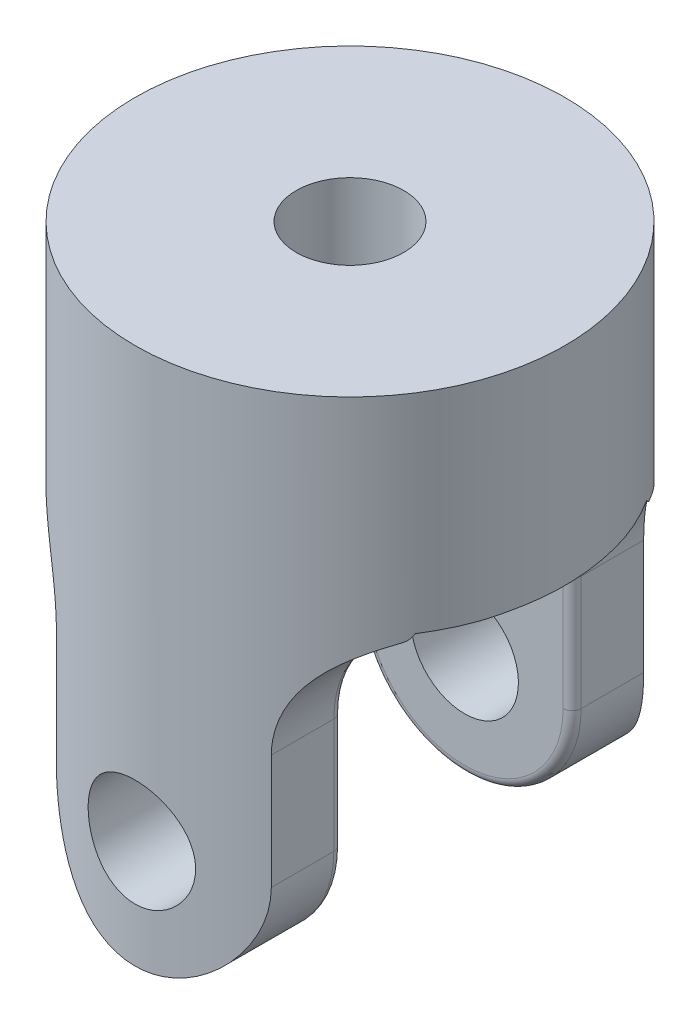
from build123d import *

# Parameters (mm, degrees)
SKETCH1_R               = 19.05
BASE_EXTRUDE_DEPTH      = 47.625
CUT_EXTRUDE1_DEPTH      = 55.716959208
CUT_EXTRUDE1_DEPTH_BACK = 55.716959208
CUT_EXTRUDE5_DEPTH      = 47.625
CUT_EXTRUDE5_DEPTH_BACK = 55.716959365
SKETCH8_W               = 20.32
SKETCH8_H               = 36.600526062
FILLET1_R               = 0.8001
CUT_EXTRUDE6_DEPTH      = 55.716959365
CUT_EXTRUDE6_DEPTH_BACK = 55.716959365
SKETCH11_R              = 4.7625
SKETCH12_R              = 4.7625
CUT_EXTRUDE7_DEPTH      = 55.716959365


with BuildPart() as part:
    # Sketch1 → Base-Extrude (new body)
    with BuildSketch(Plane(origin=(0, 0, 0), x_dir=(-1, 0, 0), z_dir=(0, 1, 0))):
        with Locations(Location((0, 0, 0), (0, 0, 90))):
            Circle(SKETCH1_R)
    extrude(amount=BASE_EXTRUDE_DEPTH)

    # Sketch2 → Cut-Extrude1 (cut, two sides: drawn at the far end of the back side and taken through both)
    with BuildSketch(Plane.XY.offset(-CUT_EXTRUDE1_DEPTH_BACK)):
        with BuildLine():
            Line((9.525, 9.525), (9.525, 19.685))
            ThreePointArc((9.525, 19.685), (12.314807909, 26.420192091), (19.05, 29.21))
            Line((19.05, 29.21), (19.05, -1.366191125))
            Line((19.05, -1.366191125), (-19.05, -1.366191125))
            Line((-19.05, -1.366191125), (-19.05, 29.21))
            ThreePointArc((-19.05, 29.21), (-12.314807909, 26.420192091), (-9.525, 19.685))
            Line((-9.525, 19.685), (-9.525, 9.525))
            ThreePointArc((-9.525, 9.525), (0, 0), (9.525, 9.525))
        make_face()
    extrude(amount=CUT_EXTRUDE1_DEPTH + CUT_EXTRUDE1_DEPTH_BACK, mode=Mode.SUBTRACT)

    # Sketch8 → Cut-Extrude5 (cut, two sides: drawn at the far end of the back side and taken through both)
    with BuildSketch(Plane(origin=(0, 0, 0), x_dir=(0, 0, -1), z_dir=(1, 0, 0)).offset(-CUT_EXTRUDE5_DEPTH_BACK)):
        with Locations((0, 10.844975795)):
            Rectangle(SKETCH8_W, SKETCH8_H)
    extrude(amount=CUT_EXTRUDE5_DEPTH + CUT_EXTRUDE5_DEPTH_BACK, mode=Mode.SUBTRACT)

    # Fillet1
    # the kernel refuses this fillet: 0.8001 mm, written as the material it takes off along each edge
    with BuildSketch(Plane(origin=(0, 9.525, -10.16), x_dir=(1, 0, 0), z_dir=(0, 1, 0))) as fillet1_piece_1:
        with BuildLine():
            CenterArc((9.525 - FILLET1_R, FILLET1_R), FILLET1_R, 270, 90)
            Line((9.525, FILLET1_R), (9.525, 0))
            Line((9.525, 0), (9.525 - FILLET1_R, 0))
        make_face()
    revolve(axis=Axis((0, 9.525, -10.16), (0, 0, -1)), revolution_arc=180, mode=Mode.SUBTRACT)
    with BuildSketch(Plane(origin=(0, 9.525, 10.16), x_dir=(1, 0, 0), z_dir=(0, 1, 0))) as fillet1_piece_2:
        with BuildLine():
            CenterArc((9.525 - FILLET1_R, -FILLET1_R), FILLET1_R, 0, 90)
            Line((9.525 - FILLET1_R, 0), (9.525, 0))
            Line((9.525, 0), (9.525, -FILLET1_R))
        make_face()
    revolve(axis=Axis((0, 9.525, 10.16), (0, 0, -1)), revolution_arc=180, mode=Mode.SUBTRACT)
    with BuildSketch(Plane(origin=(9.525, 19.685, 10.16), x_dir=(0, 0, 1), z_dir=(0, -1, 0))) as fillet1_piece_3:
        with BuildLine():
            CenterArc((FILLET1_R, FILLET1_R), FILLET1_R, 180, 90)
            Line((0, FILLET1_R), (0, 0))
            Line((0, 0), (FILLET1_R, 0))
        make_face()
    extrude(amount=10.16, mode=Mode.SUBTRACT)
    with BuildSketch(Plane(origin=(19.05, 19.685, 10.16), x_dir=(-1, 0, 0), z_dir=(0, -1, 0))) as fillet1_piece_4_section:
        with BuildLine():
            CenterArc((9.525 + FILLET1_R, -FILLET1_R), FILLET1_R, 90, 90)
            Line((9.525 + FILLET1_R, 0), (9.525, 0))
            Line((9.525, 0), (9.525, -FILLET1_R))
        make_face()
    fillet1_piece_4 = revolve(axis=Axis((19.05, 19.685, 10.16), (0, 0, -1)), revolution_arc=84.085046105, mode=Mode.PRIVATE)
    fillet1_piece_4 = split(fillet1_piece_4, bisect_by=Plane(origin=(11.180350867, 29.145238826, 10.386376784), z_dir=(0, -1, 0)), keep=Keep.TOP, mode=Mode.PRIVATE)
    add(fillet1_piece_4, mode=Mode.SUBTRACT)
    with BuildSketch(Plane(origin=(19.05, 19.685, -10.16), x_dir=(-1, 0, 0), z_dir=(0, -1, 0))) as fillet1_piece_5_section:
        with BuildLine():
            CenterArc((9.525 + FILLET1_R, FILLET1_R), FILLET1_R, 180, 90)
            Line((9.525, FILLET1_R), (9.525, 0))
            Line((9.525, 0), (9.525 + FILLET1_R, 0))
        make_face()
    fillet1_piece_5 = revolve(axis=Axis((19.05, 19.685, -10.16), (0, 0, -1)), revolution_arc=84.085046117, mode=Mode.PRIVATE)
    fillet1_piece_5 = split(fillet1_piece_5, bisect_by=Plane(origin=(9.358714509, 29.145238826, -10.293177934), z_dir=(0, -1, 0)), keep=Keep.TOP, mode=Mode.PRIVATE)
    add(fillet1_piece_5, mode=Mode.SUBTRACT)
    with BuildSketch(Plane(origin=(9.525, 9.525, -10.16), x_dir=(-1, 0, 0), z_dir=(0, 1, 0)), Plane(origin=(-9.525, 9.525, 10.16), x_dir=(1, 0, 0), z_dir=(0, 1, 0)), Plane(origin=(-9.525, 19.685, -10.16), x_dir=(1, 0, 0), z_dir=(0, -1, 0))) as fillet1_piece_6:
        with BuildLine():
            CenterArc((FILLET1_R, -FILLET1_R), FILLET1_R, 90, 90)
            Line((0, -FILLET1_R), (0, 0))
            Line((0, 0), (FILLET1_R, 0))
        make_face()
    extrude(amount=10.16, mode=Mode.SUBTRACT)
    with BuildSketch(Plane(origin=(-19.05, 19.685, 10.16), x_dir=(0.1030521452465983, 0.9946759549522016, 0), z_dir=(-0.9946759549522016, 0.1030521452465983, 0))) as fillet1_piece_7_section:
        with BuildLine():
            CenterArc((9.525 + FILLET1_R, -FILLET1_R), FILLET1_R, 90, 90)
            Line((9.525, -FILLET1_R), (9.525, 0))
            Line((9.525, 0), (9.525 + FILLET1_R, 0))
        make_face()
    fillet1_piece_7 = revolve(axis=Axis((-19.05, 19.685, 10.16), (0, 0, -1)), revolution_arc=84.085046117, mode=Mode.PRIVATE)
    fillet1_piece_7 = split(fillet1_piece_7, bisect_by=Plane(origin=(-11.180351388, 29.145238826, 10.386376138), z_dir=(0, -1, 0)), keep=Keep.TOP, mode=Mode.PRIVATE)
    add(fillet1_piece_7, mode=Mode.SUBTRACT)
    with BuildSketch(Plane(origin=(-19.05, 19.685, -10.16), x_dir=(0.10305214545411669, 0.9946759549307018, 0), z_dir=(-0.9946759549307018, 0.10305214545411669, 0))) as fillet1_piece_8_section:
        with BuildLine():
            CenterArc((9.525 + FILLET1_R, FILLET1_R), FILLET1_R, 180, 90)
            Line((9.525, FILLET1_R), (9.525, 0))
            Line((9.525, 0), (9.525 + FILLET1_R, 0))
        make_face()
    fillet1_piece_8 = revolve(axis=Axis((-19.05, 19.685, -10.16), (0, 0, -1)), revolution_arc=84.085046105, mode=Mode.PRIVATE)
    fillet1_piece_8 = split(fillet1_piece_8, bisect_by=Plane(origin=(-11.180350867, 29.145238826, -10.386376784), z_dir=(0, -1, 0)), keep=Keep.TOP, mode=Mode.PRIVATE)
    add(fillet1_piece_8, mode=Mode.SUBTRACT)

    # Sketch11 → Cut-Extrude6 (cut, two sides: drawn at the far end of the back side and taken through both)
    with BuildSketch(Plane.XY.offset(-CUT_EXTRUDE6_DEPTH_BACK)):
        with Locations(Location((0, 9.525, 0), (0, 0, 270))):
            Circle(SKETCH11_R)
    extrude(amount=CUT_EXTRUDE6_DEPTH + CUT_EXTRUDE6_DEPTH_BACK, mode=Mode.SUBTRACT)

    # Sketch12 (on Top Plane) → Cut-Extrude7 (cut, through all)
    with BuildSketch(Plane(origin=(0, 0, 0), x_dir=(1, 0, 0), z_dir=(0, 1, 0))):
        with Locations(Location((0, 0, 0), (0, 0, 270))):
            Circle(SKETCH12_R)
    extrude(amount=CUT_EXTRUDE7_DEPTH, mode=Mode.SUBTRACT)


solid = part.part
